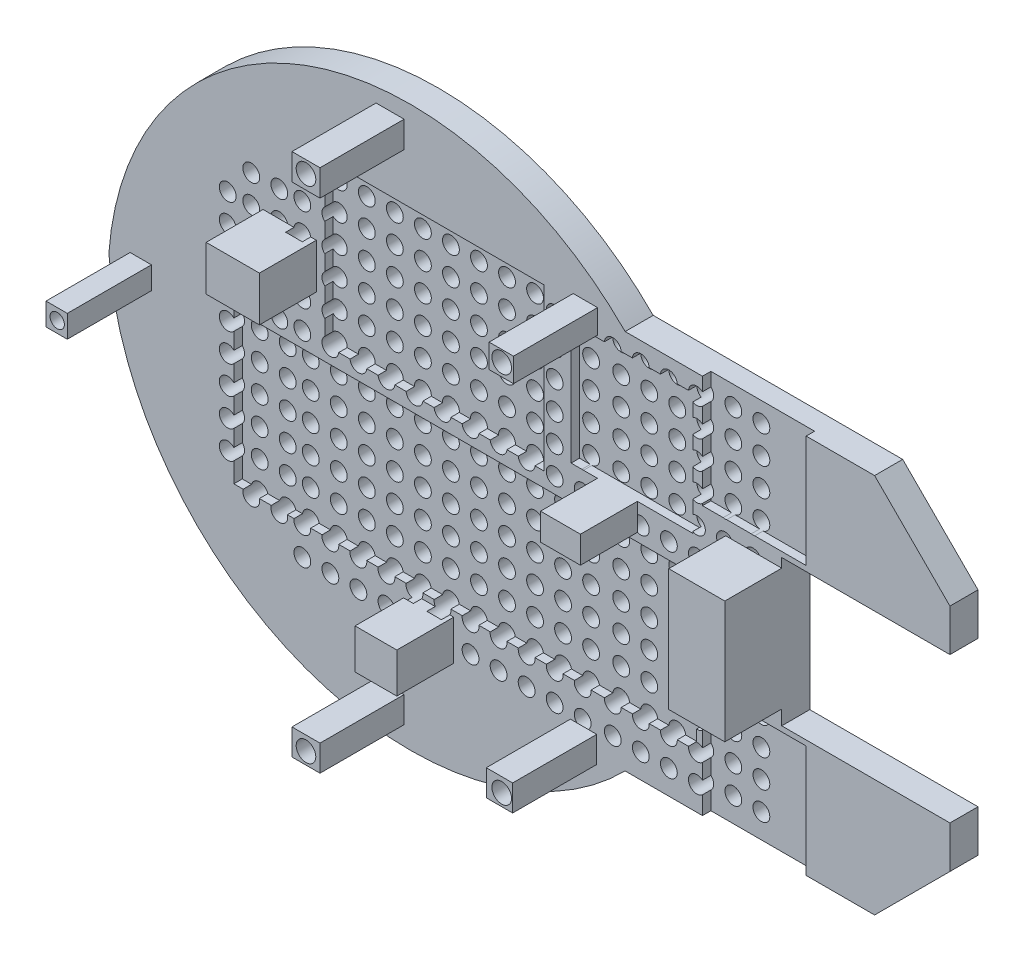
from build123d import *

# Parameters (mm, degrees)
BOSS_EXTRUDE1_DEPTH      = 10
BOSS_EXTRUDE1_DEPTH_BACK = 0.01
SKETCH3_W                = 37
SKETCH3_H                = 40
CUT_EXTRUDE1_DEPTH       = 3
SKETCH5_W                = 37
SKETCH5_H                = 40
CUT_EXTRUDE3_DEPTH       = 3
SKETCH7_W                = 165
SKETCH7_H                = 54
CUT_EXTRUDE4_DEPTH       = 3
SKETCH8_W                = 78.2
SKETCH8_H                = 57.5
CUT_EXTRUDE5_DEPTH       = 3
SKETCH9_W                = 19
SKETCH9_H                = 16
SKETCH9_W_2              = 14.238670971
SKETCH9_H_2              = 13.143388588
SKETCH9_W_3              = 14.8958404
SKETCH9_H_3              = 14.23867097
BOSS_EXTRUDE2_DEPTH      = 20.3
SKETCH11_R               = 3
CUT_EXTRUDE12_DEPTH      = 13
CUT_EXTRUDE13_REACH      = 263.683
SKETCH12_R               = 3
CUT_EXTRUDE14_REACH      = 263.683
SKETCH13_R               = 3
SKETCH14_R               = 3
CUT_EXTRUDE16_DEPTH      = 10.01
SKETCH15_W               = 20
SKETCH15_H               = 43.5
BOSS_EXTRUDE3_DEPTH      = 20.3
SKETCH16_W               = 7.597238681
SKETCH16_H               = 8
SKETCH16_W_2             = 10
SKETCH16_H_2             = 9.4
SKETCH16_W_3             = 8.7
SKETCH16_H_3             = 8.5
SKETCH16_W_4             = 9.4
SKETCH16_H_4             = 9.3
BOSS_EXTRUDE4_DEPTH      = 30
SKETCH17_R               = 2.55
SKETCH17_R_2             = 3.5
CUT_EXTRUDE17_DEPTH      = 263.98121496
SKETCH18_W               = 43.4
SKETCH18_H               = 43.4
CUT_EXTRUDE18_DEPTH      = 3
SKETCH19_W               = 14.238670971
SKETCH19_H               = 3.554233488
CUT_EXTRUDE19_DEPTH      = 23.3


with BuildPart() as part:
    # Sketch1 → Boss-Extrude1 (new, two sides: drawn at the far end of the back side and taken through both)
    with BuildSketch(Plane.XY.offset(-BOSS_EXTRUDE1_DEPTH_BACK)):
        with BuildLine():
            Line((0, 0), (0, -26))
            Line((0, -26), (60, -26))
            Line((60, -26), (60, -41))
            Line((60, -41), (33.129942315, -67.870057685))
            Line((33.129942315, -67.870057685), (-55.850057685, -67.870057685))
            ThreePointArc((-55.850057685, -67.870057685), (-169.745893523, -93.14097487), (-240, 0))
            ThreePointArc((-240, 0), (-169.745893523, 93.14097487), (-55.850057685, 67.870057685))
            Line((-55.850057685, 67.870057685), (33.129942315, 67.870057685))
            Line((33.129942315, 67.870057685), (60, 41))
            Line((60, 41), (60, 26))
            Line((60, 26), (0, 26))
            Line((0, 26), (0, 0))
        make_face()
    extrude(amount=BOSS_EXTRUDE1_DEPTH + BOSS_EXTRUDE1_DEPTH_BACK)

    # Sketch3 → Cut-Extrude1 (cut)
    with BuildSketch(Plane.XY.offset(10)):
        with Locations((-9.773002586, 47.870057685)):
            Rectangle(SKETCH3_W, SKETCH3_H)
    extrude(amount=-CUT_EXTRUDE1_DEPTH, mode=Mode.SUBTRACT)

    # Sketch5 → Cut-Extrude3 (cut)
    with BuildSketch(Plane.XY.offset(10)):
        with Locations((-9.773002586, -47.870057685)):
            Rectangle(SKETCH5_W, SKETCH5_H)
    extrude(amount=-CUT_EXTRUDE3_DEPTH, mode=Mode.SUBTRACT)

    # Sketch7 → Cut-Extrude4 (cut)
    with BuildSketch(Plane.XY.offset(10)):
        with Locations((-112.913094129, -21.943838981)):
            Rectangle(SKETCH7_W, SKETCH7_H)
    extrude(amount=-CUT_EXTRUDE4_DEPTH, mode=Mode.SUBTRACT)

    # Sketch8 → Cut-Extrude5 (cut)
    with BuildSketch(Plane.XY.offset(10)):
        with Locations((-123.892735612, 39.063262975)):
            Rectangle(SKETCH8_W, SKETCH8_H)
    extrude(amount=-CUT_EXTRUDE5_DEPTH, mode=Mode.SUBTRACT)

    # Sketch9 → Boss-Extrude2 (add)
    with BuildSketch(Plane.XY.offset(10)):
        with Locations((-175.5, 33)):
            Rectangle(SKETCH9_W, SKETCH9_H)
        with Locations((-58.612324577, 14.582539194)):
            Rectangle(SKETCH9_W_2, SKETCH9_H_2)
        with Locations((-124.438795754, -58.044490005)):
            Rectangle(SKETCH9_W_3, SKETCH9_H_3)
    extrude(amount=BOSS_EXTRUDE2_DEPTH)

    # Sketch11 → Cut-Extrude12 (cut)
    with BuildSketch(Plane(origin=(0, 0, -0.01), x_dir=(-1, 0, 0), z_dir=(0, 0, -1))):
        with Locations((70.989015497, 60.584399251)):
            Circle(SKETCH11_R)
        with Locations((80.989015497, 60.584399251)):
            Circle(SKETCH11_R)
        with Locations((90.989015497, 60.584399251)):
            Circle(SKETCH11_R)
        with Locations((100.989015497, 60.584399251)):
            Circle(SKETCH11_R)
        with Locations((110.989015497, 60.584399251)):
            Circle(SKETCH11_R)
        with Locations((120.989015497, 60.584399251)):
            Circle(SKETCH11_R)
        with Locations((130.989015497, 60.584399251)):
            Circle(SKETCH11_R)
        with Locations((140.989015497, 60.584399251)):
            Circle(SKETCH11_R)
        with Locations((150.989015497, 60.584399251)):
            Circle(SKETCH11_R)
        with Locations((160.989015497, 60.584399251)):
            Circle(SKETCH11_R)
        with Locations((170.989015497, 60.584399251)):
            Circle(SKETCH11_R)
        with Locations((80.989015497, 50.584399251)):
            Circle(SKETCH11_R)
        with Locations((90.989015497, 50.584399251)):
            Circle(SKETCH11_R)
        with Locations((100.989015497, 50.584399251)):
            Circle(SKETCH11_R)
        with Locations((110.989015497, 50.584399251)):
            Circle(SKETCH11_R)
        with Locations((120.989015497, 50.584399251)):
            Circle(SKETCH11_R)
        with Locations((130.989015497, 50.584399251)):
            Circle(SKETCH11_R)
        with Locations((140.989015497, 50.584399251)):
            Circle(SKETCH11_R)
        with Locations((150.989015497, 50.584399251)):
            Circle(SKETCH11_R)
        with Locations((160.989015497, 50.584399251)):
            Circle(SKETCH11_R)
        with Locations((170.989015497, 50.584399251)):
            Circle(SKETCH11_R)
        with Locations((80.989015497, 40.584399251)):
            Circle(SKETCH11_R)
        with Locations((90.989015497, 40.584399251)):
            Circle(SKETCH11_R)
        with Locations((100.989015497, 40.584399251)):
            Circle(SKETCH11_R)
        with Locations((110.989015497, 40.584399251)):
            Circle(SKETCH11_R)
        with Locations((120.989015497, 40.584399251)):
            Circle(SKETCH11_R)
        with Locations((130.989015497, 40.584399251)):
            Circle(SKETCH11_R)
        with Locations((140.989015497, 40.584399251)):
            Circle(SKETCH11_R)
        with Locations((150.989015497, 40.584399251)):
            Circle(SKETCH11_R)
        with Locations((160.989015497, 40.584399251)):
            Circle(SKETCH11_R)
        with Locations((170.989015497, 40.584399251)):
            Circle(SKETCH11_R)
        with Locations((80.989015497, 30.584399251)):
            Circle(SKETCH11_R)
        with Locations((90.989015497, 30.584399251)):
            Circle(SKETCH11_R)
        with Locations((100.989015497, 30.584399251)):
            Circle(SKETCH11_R)
        with Locations((110.989015497, 30.584399251)):
            Circle(SKETCH11_R)
        with Locations((120.989015497, 30.584399251)):
            Circle(SKETCH11_R)
        with Locations((130.989015497, 30.584399251)):
            Circle(SKETCH11_R)
        with Locations((140.989015497, 30.584399251)):
            Circle(SKETCH11_R)
        with Locations((150.989015497, 30.584399251)):
            Circle(SKETCH11_R)
        with Locations((160.989015497, 30.584399251)):
            Circle(SKETCH11_R)
        with Locations((170.989015497, 30.584399251)):
            Circle(SKETCH11_R)
        with Locations((80.989015497, 20.584399251)):
            Circle(SKETCH11_R)
        with Locations((90.989015497, 20.584399251)):
            Circle(SKETCH11_R)
        with Locations((100.989015497, 20.584399251)):
            Circle(SKETCH11_R)
        with Locations((110.989015497, 20.584399251)):
            Circle(SKETCH11_R)
        with Locations((120.989015497, 20.584399251)):
            Circle(SKETCH11_R)
        with Locations((130.989015497, 20.584399251)):
            Circle(SKETCH11_R)
        with Locations((140.989015497, 20.584399251)):
            Circle(SKETCH11_R)
        with Locations((150.989015497, 20.584399251)):
            Circle(SKETCH11_R)
        with Locations((160.989015497, 20.584399251)):
            Circle(SKETCH11_R)
        with Locations((170.989015497, 20.584399251)):
            Circle(SKETCH11_R)
        with Locations((80.989015497, 10.584399251)):
            Circle(SKETCH11_R)
        with Locations((90.989015497, 10.584399251)):
            Circle(SKETCH11_R)
        with Locations((100.989015497, 10.584399251)):
            Circle(SKETCH11_R)
        with Locations((110.989015497, 10.584399251)):
            Circle(SKETCH11_R)
        with Locations((120.989015497, 10.584399251)):
            Circle(SKETCH11_R)
        with Locations((130.989015497, 10.584399251)):
            Circle(SKETCH11_R)
        with Locations((140.989015497, 10.584399251)):
            Circle(SKETCH11_R)
        with Locations((150.989015497, 10.584399251)):
            Circle(SKETCH11_R)
        with Locations((160.989015497, 10.584399251)):
            Circle(SKETCH11_R)
        with Locations((170.989015497, 10.584399251)):
            Circle(SKETCH11_R)
        with Locations((80.989015497, 0.584399251)):
            Circle(SKETCH11_R)
        with Locations((90.989015497, 0.584399251)):
            Circle(SKETCH11_R)
        with Locations((100.989015497, 0.584399251)):
            Circle(SKETCH11_R)
        with Locations((110.989015497, 0.584399251)):
            Circle(SKETCH11_R)
        with Locations((120.989015497, 0.584399251)):
            Circle(SKETCH11_R)
        with Locations((130.989015497, 0.584399251)):
            Circle(SKETCH11_R)
        with Locations((140.989015497, 0.584399251)):
            Circle(SKETCH11_R)
        with Locations((150.989015497, 0.584399251)):
            Circle(SKETCH11_R)
        with Locations((160.989015497, 0.584399251)):
            Circle(SKETCH11_R)
        with Locations((170.989015497, 0.584399251)):
            Circle(SKETCH11_R)
        with Locations((80.989015497, -9.415600749)):
            Circle(SKETCH11_R)
        with Locations((90.989015497, -9.415600749)):
            Circle(SKETCH11_R)
        with Locations((100.989015497, -9.415600749)):
            Circle(SKETCH11_R)
        with Locations((110.989015497, -9.415600749)):
            Circle(SKETCH11_R)
        with Locations((120.989015497, -9.415600749)):
            Circle(SKETCH11_R)
        with Locations((130.989015497, -9.415600749)):
            Circle(SKETCH11_R)
        with Locations((140.989015497, -9.415600749)):
            Circle(SKETCH11_R)
        with Locations((150.989015497, -9.415600749)):
            Circle(SKETCH11_R)
        with Locations((160.989015497, -9.415600749)):
            Circle(SKETCH11_R)
        with Locations((170.989015497, -9.415600749)):
            Circle(SKETCH11_R)
        with Locations((80.989015497, -19.415600749)):
            Circle(SKETCH11_R)
        with Locations((90.989015497, -19.415600749)):
            Circle(SKETCH11_R)
        with Locations((100.989015497, -19.415600749)):
            Circle(SKETCH11_R)
        with Locations((110.989015497, -19.415600749)):
            Circle(SKETCH11_R)
        with Locations((120.989015497, -19.415600749)):
            Circle(SKETCH11_R)
        with Locations((130.989015497, -19.415600749)):
            Circle(SKETCH11_R)
        with Locations((140.989015497, -19.415600749)):
            Circle(SKETCH11_R)
        with Locations((150.989015497, -19.415600749)):
            Circle(SKETCH11_R)
        with Locations((160.989015497, -19.415600749)):
            Circle(SKETCH11_R)
        with Locations((170.989015497, -19.415600749)):
            Circle(SKETCH11_R)
        with Locations((80.989015497, -29.415600749)):
            Circle(SKETCH11_R)
        with Locations((90.989015497, -29.415600749)):
            Circle(SKETCH11_R)
        with Locations((100.989015497, -29.415600749)):
            Circle(SKETCH11_R)
        with Locations((110.989015497, -29.415600749)):
            Circle(SKETCH11_R)
        with Locations((120.989015497, -29.415600749)):
            Circle(SKETCH11_R)
        with Locations((130.989015497, -29.415600749)):
            Circle(SKETCH11_R)
        with Locations((140.989015497, -29.415600749)):
            Circle(SKETCH11_R)
        with Locations((150.989015497, -29.415600749)):
            Circle(SKETCH11_R)
        with Locations((160.989015497, -29.415600749)):
            Circle(SKETCH11_R)
        with Locations((170.989015497, -29.415600749)):
            Circle(SKETCH11_R)
        with Locations((80.989015497, -39.415600749)):
            Circle(SKETCH11_R)
        with Locations((90.989015497, -39.415600749)):
            Circle(SKETCH11_R)
        with Locations((100.989015497, -39.415600749)):
            Circle(SKETCH11_R)
        with Locations((110.989015497, -39.415600749)):
            Circle(SKETCH11_R)
        with Locations((120.989015497, -39.415600749)):
            Circle(SKETCH11_R)
        with Locations((130.989015497, -39.415600749)):
            Circle(SKETCH11_R)
        with Locations((140.989015497, -39.415600749)):
            Circle(SKETCH11_R)
        with Locations((150.989015497, -39.415600749)):
            Circle(SKETCH11_R)
        with Locations((160.989015497, -39.415600749)):
            Circle(SKETCH11_R)
        with Locations((170.989015497, -39.415600749)):
            Circle(SKETCH11_R)
        with Locations((80.989015497, -49.415600749)):
            Circle(SKETCH11_R)
        with Locations((90.989015497, -49.415600749)):
            Circle(SKETCH11_R)
        with Locations((100.989015497, -49.415600749)):
            Circle(SKETCH11_R)
        with Locations((110.989015497, -49.415600749)):
            Circle(SKETCH11_R)
        with Locations((120.989015497, -49.415600749)):
            Circle(SKETCH11_R)
        with Locations((130.989015497, -49.415600749)):
            Circle(SKETCH11_R)
        with Locations((140.989015497, -49.415600749)):
            Circle(SKETCH11_R)
        with Locations((150.989015497, -49.415600749)):
            Circle(SKETCH11_R)
        with Locations((160.989015497, -49.415600749)):
            Circle(SKETCH11_R)
        with Locations((170.989015497, -49.415600749)):
            Circle(SKETCH11_R)
        with Locations((80.989015497, -59.415600749)):
            Circle(SKETCH11_R)
        with Locations((90.989015497, -59.415600749)):
            Circle(SKETCH11_R)
        with Locations((100.989015497, -59.415600749)):
            Circle(SKETCH11_R)
        with Locations((110.989015497, -59.415600749)):
            Circle(SKETCH11_R)
        with Locations((120.989015497, -59.415600749)):
            Circle(SKETCH11_R)
        with Locations((130.989015497, -59.415600749)):
            Circle(SKETCH11_R)
        with Locations((140.989015497, -59.415600749)):
            Circle(SKETCH11_R)
        with Locations((150.989015497, -59.415600749)):
            Circle(SKETCH11_R)
        with Locations((160.989015497, -59.415600749)):
            Circle(SKETCH11_R)
        with Locations((170.989015497, -59.415600749)):
            Circle(SKETCH11_R)
        with Locations((70.989015497, 50.584399251)):
            Circle(SKETCH11_R)
        with Locations((70.989015497, 40.584399251)):
            Circle(SKETCH11_R)
        with Locations((70.989015497, 30.584399251)):
            Circle(SKETCH11_R)
        with Locations((70.989015497, 20.584399251)):
            Circle(SKETCH11_R)
        with Locations((70.989015497, 10.584399251)):
            Circle(SKETCH11_R)
        with Locations((70.989015497, 0.584399251)):
            Circle(SKETCH11_R)
        with Locations((70.989015497, -9.415600749)):
            Circle(SKETCH11_R)
        with Locations((70.989015497, -19.415600749)):
            Circle(SKETCH11_R)
        with Locations((70.989015497, -29.415600749)):
            Circle(SKETCH11_R)
        with Locations((70.989015497, -39.415600749)):
            Circle(SKETCH11_R)
        with Locations((70.989015497, -49.415600749)):
            Circle(SKETCH11_R)
        with Locations((70.989015497, -59.415600749)):
            Circle(SKETCH11_R)
    extrude(amount=-CUT_EXTRUDE12_DEPTH, mode=Mode.SUBTRACT)

    # Cut-Extrude13: up to this face of the body (flat: up to its plane)
    cut_extrude13_end = Plane(part.part.faces().sort_by_distance((56.396717085, 33.5, 10))[0])
    # Sketch12 → Cut-Extrude13 (cut, up to the picked face)
    with BuildSketch(Plane(origin=(0, 0, -0.01), x_dir=(-1, 0, 0), z_dir=(0, 0, -1)), mode=Mode.PRIVATE) as cut_extrude13_sk1:
        with Locations((179.20291487, 50.26025315)):
            Circle(SKETCH12_R)
    cut_extrude13_tool1 = split(extrude(cut_extrude13_sk1.sketch, amount=-CUT_EXTRUDE13_REACH, mode=Mode.PRIVATE), bisect_by=cut_extrude13_end, keep=Keep.BOTH, mode=Mode.PRIVATE)
    # Sketch12 → Cut-Extrude13 (cut, up to the picked face)
    with BuildSketch(Plane(origin=(0, 0, -0.01), x_dir=(-1, 0, 0), z_dir=(0, 0, -1)), mode=Mode.PRIVATE) as cut_extrude13_sk2:
        with Locations((189.20291487, 50.26025315)):
            Circle(SKETCH12_R)
    cut_extrude13_tool2 = split(extrude(cut_extrude13_sk2.sketch, amount=-CUT_EXTRUDE13_REACH, mode=Mode.PRIVATE), bisect_by=cut_extrude13_end, keep=Keep.BOTH, mode=Mode.PRIVATE)
    # Sketch12 → Cut-Extrude13 (cut, up to the picked face)
    with BuildSketch(Plane(origin=(0, 0, -0.01), x_dir=(-1, 0, 0), z_dir=(0, 0, -1)), mode=Mode.PRIVATE) as cut_extrude13_sk3:
        with Locations((189.20291487, 40.26025315)):
            Circle(SKETCH12_R)
    cut_extrude13_tool3 = split(extrude(cut_extrude13_sk3.sketch, amount=-CUT_EXTRUDE13_REACH, mode=Mode.PRIVATE), bisect_by=cut_extrude13_end, keep=Keep.BOTH, mode=Mode.PRIVATE)
    # Sketch12 → Cut-Extrude13 (cut, up to the picked face)
    with BuildSketch(Plane(origin=(0, 0, -0.01), x_dir=(-1, 0, 0), z_dir=(0, 0, -1)), mode=Mode.PRIVATE) as cut_extrude13_sk4:
        with Locations((189.20291487, 30.26025315)):
            Circle(SKETCH12_R)
    cut_extrude13_tool4 = split(extrude(cut_extrude13_sk4.sketch, amount=-CUT_EXTRUDE13_REACH, mode=Mode.PRIVATE), bisect_by=cut_extrude13_end, keep=Keep.BOTH, mode=Mode.PRIVATE)
    # Sketch12 → Cut-Extrude13 (cut, up to the picked face)
    with BuildSketch(Plane(origin=(0, 0, -0.01), x_dir=(-1, 0, 0), z_dir=(0, 0, -1)), mode=Mode.PRIVATE) as cut_extrude13_sk5:
        with Locations((189.20291487, 20.26025315)):
            Circle(SKETCH12_R)
    cut_extrude13_tool5 = split(extrude(cut_extrude13_sk5.sketch, amount=-CUT_EXTRUDE13_REACH, mode=Mode.PRIVATE), bisect_by=cut_extrude13_end, keep=Keep.BOTH, mode=Mode.PRIVATE)
    # Sketch12 → Cut-Extrude13 (cut, up to the picked face)
    with BuildSketch(Plane(origin=(0, 0, -0.01), x_dir=(-1, 0, 0), z_dir=(0, 0, -1)), mode=Mode.PRIVATE) as cut_extrude13_sk6:
        with Locations((189.20291487, 10.26025315)):
            Circle(SKETCH12_R)
    cut_extrude13_tool6 = split(extrude(cut_extrude13_sk6.sketch, amount=-CUT_EXTRUDE13_REACH, mode=Mode.PRIVATE), bisect_by=cut_extrude13_end, keep=Keep.BOTH, mode=Mode.PRIVATE)
    # Sketch12 → Cut-Extrude13 (cut, up to the picked face)
    with BuildSketch(Plane(origin=(0, 0, -0.01), x_dir=(-1, 0, 0), z_dir=(0, 0, -1)), mode=Mode.PRIVATE) as cut_extrude13_sk7:
        with Locations((189.20291487, 0.26025315)):
            Circle(SKETCH12_R)
    cut_extrude13_tool7 = split(extrude(cut_extrude13_sk7.sketch, amount=-CUT_EXTRUDE13_REACH, mode=Mode.PRIVATE), bisect_by=cut_extrude13_end, keep=Keep.BOTH, mode=Mode.PRIVATE)
    # Sketch12 → Cut-Extrude13 (cut, up to the picked face)
    with BuildSketch(Plane(origin=(0, 0, -0.01), x_dir=(-1, 0, 0), z_dir=(0, 0, -1)), mode=Mode.PRIVATE) as cut_extrude13_sk8:
        with Locations((189.20291487, -9.73974685)):
            Circle(SKETCH12_R)
    cut_extrude13_tool8 = split(extrude(cut_extrude13_sk8.sketch, amount=-CUT_EXTRUDE13_REACH, mode=Mode.PRIVATE), bisect_by=cut_extrude13_end, keep=Keep.BOTH, mode=Mode.PRIVATE)
    # Sketch12 → Cut-Extrude13 (cut, up to the picked face)
    with BuildSketch(Plane(origin=(0, 0, -0.01), x_dir=(-1, 0, 0), z_dir=(0, 0, -1)), mode=Mode.PRIVATE) as cut_extrude13_sk9:
        with Locations((189.20291487, -19.73974685)):
            Circle(SKETCH12_R)
    cut_extrude13_tool9 = split(extrude(cut_extrude13_sk9.sketch, amount=-CUT_EXTRUDE13_REACH, mode=Mode.PRIVATE), bisect_by=cut_extrude13_end, keep=Keep.BOTH, mode=Mode.PRIVATE)
    # Sketch12 → Cut-Extrude13 (cut, up to the picked face)
    with BuildSketch(Plane(origin=(0, 0, -0.01), x_dir=(-1, 0, 0), z_dir=(0, 0, -1)), mode=Mode.PRIVATE) as cut_extrude13_sk10:
        with Locations((189.20291487, -29.73974685)):
            Circle(SKETCH12_R)
    cut_extrude13_tool10 = split(extrude(cut_extrude13_sk10.sketch, amount=-CUT_EXTRUDE13_REACH, mode=Mode.PRIVATE), bisect_by=cut_extrude13_end, keep=Keep.BOTH, mode=Mode.PRIVATE)
    # Sketch12 → Cut-Extrude13 (cut, up to the picked face)
    with BuildSketch(Plane(origin=(0, 0, -0.01), x_dir=(-1, 0, 0), z_dir=(0, 0, -1)), mode=Mode.PRIVATE) as cut_extrude13_sk11:
        with Locations((189.20291487, -39.73974685)):
            Circle(SKETCH12_R)
    cut_extrude13_tool11 = split(extrude(cut_extrude13_sk11.sketch, amount=-CUT_EXTRUDE13_REACH, mode=Mode.PRIVATE), bisect_by=cut_extrude13_end, keep=Keep.BOTH, mode=Mode.PRIVATE)
    # Sketch12 → Cut-Extrude13 (cut, up to the picked face)
    with BuildSketch(Plane(origin=(0, 0, -0.01), x_dir=(-1, 0, 0), z_dir=(0, 0, -1)), mode=Mode.PRIVATE) as cut_extrude13_sk12:
        with Locations((189.20291487, -49.73974685)):
            Circle(SKETCH12_R)
    cut_extrude13_tool12 = split(extrude(cut_extrude13_sk12.sketch, amount=-CUT_EXTRUDE13_REACH, mode=Mode.PRIVATE), bisect_by=cut_extrude13_end, keep=Keep.BOTH, mode=Mode.PRIVATE)
    # Sketch12 → Cut-Extrude13 (cut, up to the picked face)
    with BuildSketch(Plane(origin=(0, 0, -0.01), x_dir=(-1, 0, 0), z_dir=(0, 0, -1)), mode=Mode.PRIVATE) as cut_extrude13_sk13:
        with Locations((179.20291487, 40.26025315)):
            Circle(SKETCH12_R)
    cut_extrude13_tool13 = split(extrude(cut_extrude13_sk13.sketch, amount=-CUT_EXTRUDE13_REACH, mode=Mode.PRIVATE), bisect_by=cut_extrude13_end, keep=Keep.BOTH, mode=Mode.PRIVATE)
    # Sketch12 → Cut-Extrude13 (cut, up to the picked face)
    with BuildSketch(Plane(origin=(0, 0, -0.01), x_dir=(-1, 0, 0), z_dir=(0, 0, -1)), mode=Mode.PRIVATE) as cut_extrude13_sk14:
        with Locations((179.20291487, 30.26025315)):
            Circle(SKETCH12_R)
    cut_extrude13_tool14 = split(extrude(cut_extrude13_sk14.sketch, amount=-CUT_EXTRUDE13_REACH, mode=Mode.PRIVATE), bisect_by=cut_extrude13_end, keep=Keep.BOTH, mode=Mode.PRIVATE)
    # Sketch12 → Cut-Extrude13 (cut, up to the picked face)
    with BuildSketch(Plane(origin=(0, 0, -0.01), x_dir=(-1, 0, 0), z_dir=(0, 0, -1)), mode=Mode.PRIVATE) as cut_extrude13_sk15:
        with Locations((179.20291487, 20.26025315)):
            Circle(SKETCH12_R)
    cut_extrude13_tool15 = split(extrude(cut_extrude13_sk15.sketch, amount=-CUT_EXTRUDE13_REACH, mode=Mode.PRIVATE), bisect_by=cut_extrude13_end, keep=Keep.BOTH, mode=Mode.PRIVATE)
    # Sketch12 → Cut-Extrude13 (cut, up to the picked face)
    with BuildSketch(Plane(origin=(0, 0, -0.01), x_dir=(-1, 0, 0), z_dir=(0, 0, -1)), mode=Mode.PRIVATE) as cut_extrude13_sk16:
        with Locations((179.20291487, 10.26025315)):
            Circle(SKETCH12_R)
    cut_extrude13_tool16 = split(extrude(cut_extrude13_sk16.sketch, amount=-CUT_EXTRUDE13_REACH, mode=Mode.PRIVATE), bisect_by=cut_extrude13_end, keep=Keep.BOTH, mode=Mode.PRIVATE)
    # Sketch12 → Cut-Extrude13 (cut, up to the picked face)
    with BuildSketch(Plane(origin=(0, 0, -0.01), x_dir=(-1, 0, 0), z_dir=(0, 0, -1)), mode=Mode.PRIVATE) as cut_extrude13_sk17:
        with Locations((179.20291487, 0.26025315)):
            Circle(SKETCH12_R)
    cut_extrude13_tool17 = split(extrude(cut_extrude13_sk17.sketch, amount=-CUT_EXTRUDE13_REACH, mode=Mode.PRIVATE), bisect_by=cut_extrude13_end, keep=Keep.BOTH, mode=Mode.PRIVATE)
    # Sketch12 → Cut-Extrude13 (cut, up to the picked face)
    with BuildSketch(Plane(origin=(0, 0, -0.01), x_dir=(-1, 0, 0), z_dir=(0, 0, -1)), mode=Mode.PRIVATE) as cut_extrude13_sk18:
        with Locations((179.20291487, -9.73974685)):
            Circle(SKETCH12_R)
    cut_extrude13_tool18 = split(extrude(cut_extrude13_sk18.sketch, amount=-CUT_EXTRUDE13_REACH, mode=Mode.PRIVATE), bisect_by=cut_extrude13_end, keep=Keep.BOTH, mode=Mode.PRIVATE)
    # Sketch12 → Cut-Extrude13 (cut, up to the picked face)
    with BuildSketch(Plane(origin=(0, 0, -0.01), x_dir=(-1, 0, 0), z_dir=(0, 0, -1)), mode=Mode.PRIVATE) as cut_extrude13_sk19:
        with Locations((179.20291487, -19.73974685)):
            Circle(SKETCH12_R)
    cut_extrude13_tool19 = split(extrude(cut_extrude13_sk19.sketch, amount=-CUT_EXTRUDE13_REACH, mode=Mode.PRIVATE), bisect_by=cut_extrude13_end, keep=Keep.BOTH, mode=Mode.PRIVATE)
    # Sketch12 → Cut-Extrude13 (cut, up to the picked face)
    with BuildSketch(Plane(origin=(0, 0, -0.01), x_dir=(-1, 0, 0), z_dir=(0, 0, -1)), mode=Mode.PRIVATE) as cut_extrude13_sk20:
        with Locations((179.20291487, -29.73974685)):
            Circle(SKETCH12_R)
    cut_extrude13_tool20 = split(extrude(cut_extrude13_sk20.sketch, amount=-CUT_EXTRUDE13_REACH, mode=Mode.PRIVATE), bisect_by=cut_extrude13_end, keep=Keep.BOTH, mode=Mode.PRIVATE)
    # Sketch12 → Cut-Extrude13 (cut, up to the picked face)
    with BuildSketch(Plane(origin=(0, 0, -0.01), x_dir=(-1, 0, 0), z_dir=(0, 0, -1)), mode=Mode.PRIVATE) as cut_extrude13_sk21:
        with Locations((179.20291487, -39.73974685)):
            Circle(SKETCH12_R)
    cut_extrude13_tool21 = split(extrude(cut_extrude13_sk21.sketch, amount=-CUT_EXTRUDE13_REACH, mode=Mode.PRIVATE), bisect_by=cut_extrude13_end, keep=Keep.BOTH, mode=Mode.PRIVATE)
    # Sketch12 → Cut-Extrude13 (cut, up to the picked face)
    with BuildSketch(Plane(origin=(0, 0, -0.01), x_dir=(-1, 0, 0), z_dir=(0, 0, -1)), mode=Mode.PRIVATE) as cut_extrude13_sk22:
        with Locations((179.20291487, -49.73974685)):
            Circle(SKETCH12_R)
    cut_extrude13_tool22 = split(extrude(cut_extrude13_sk22.sketch, amount=-CUT_EXTRUDE13_REACH, mode=Mode.PRIVATE), bisect_by=cut_extrude13_end, keep=Keep.BOTH, mode=Mode.PRIVATE)
    add(cut_extrude13_tool1.solids().sort_by(Axis((-179.202915, 50.260253, -0.01), (0, 0, 1)))[0], mode=Mode.SUBTRACT)
    add(cut_extrude13_tool2.solids().sort_by(Axis((-189.202915, 50.260253, -0.01), (0, 0, 1)))[0], mode=Mode.SUBTRACT)
    add(cut_extrude13_tool3.solids().sort_by(Axis((-189.202915, 40.260253, -0.01), (0, 0, 1)))[0], mode=Mode.SUBTRACT)
    add(cut_extrude13_tool4.solids().sort_by(Axis((-189.202915, 30.260253, -0.01), (0, 0, 1)))[0], mode=Mode.SUBTRACT)
    add(cut_extrude13_tool5.solids().sort_by(Axis((-189.202915, 20.260253, -0.01), (0, 0, 1)))[0], mode=Mode.SUBTRACT)
    add(cut_extrude13_tool6.solids().sort_by(Axis((-189.202915, 10.260253, -0.01), (0, 0, 1)))[0], mode=Mode.SUBTRACT)
    add(cut_extrude13_tool7.solids().sort_by(Axis((-189.202915, 0.260253, -0.01), (0, 0, 1)))[0], mode=Mode.SUBTRACT)
    add(cut_extrude13_tool8.solids().sort_by(Axis((-189.202915, -9.739747, -0.01), (0, 0, 1)))[0], mode=Mode.SUBTRACT)
    add(cut_extrude13_tool9.solids().sort_by(Axis((-189.202915, -19.739747, -0.01), (0, 0, 1)))[0], mode=Mode.SUBTRACT)
    add(cut_extrude13_tool10.solids().sort_by(Axis((-189.202915, -29.739747, -0.01), (0, 0, 1)))[0], mode=Mode.SUBTRACT)
    add(cut_extrude13_tool11.solids().sort_by(Axis((-189.202915, -39.739747, -0.01), (0, 0, 1)))[0], mode=Mode.SUBTRACT)
    add(cut_extrude13_tool12.solids().sort_by(Axis((-189.202915, -49.739747, -0.01), (0, 0, 1)))[0], mode=Mode.SUBTRACT)
    add(cut_extrude13_tool13.solids().sort_by(Axis((-179.202915, 40.260253, -0.01), (0, 0, 1)))[0], mode=Mode.SUBTRACT)
    add(cut_extrude13_tool14.solids().sort_by(Axis((-179.202915, 30.260253, -0.01), (0, 0, 1)))[0], mode=Mode.SUBTRACT)
    add(cut_extrude13_tool15.solids().sort_by(Axis((-179.202915, 20.260253, -0.01), (0, 0, 1)))[0], mode=Mode.SUBTRACT)
    add(cut_extrude13_tool16.solids().sort_by(Axis((-179.202915, 10.260253, -0.01), (0, 0, 1)))[0], mode=Mode.SUBTRACT)
    add(cut_extrude13_tool17.solids().sort_by(Axis((-179.202915, 0.260253, -0.01), (0, 0, 1)))[0], mode=Mode.SUBTRACT)
    add(cut_extrude13_tool18.solids().sort_by(Axis((-179.202915, -9.739747, -0.01), (0, 0, 1)))[0], mode=Mode.SUBTRACT)
    add(cut_extrude13_tool19.solids().sort_by(Axis((-179.202915, -19.739747, -0.01), (0, 0, 1)))[0], mode=Mode.SUBTRACT)
    add(cut_extrude13_tool20.solids().sort_by(Axis((-179.202915, -29.739747, -0.01), (0, 0, 1)))[0], mode=Mode.SUBTRACT)
    add(cut_extrude13_tool21.solids().sort_by(Axis((-179.202915, -39.739747, -0.01), (0, 0, 1)))[0], mode=Mode.SUBTRACT)
    add(cut_extrude13_tool22.solids().sort_by(Axis((-179.202915, -49.739747, -0.01), (0, 0, 1)))[0], mode=Mode.SUBTRACT)

    # Cut-Extrude14: up to this face of the body (flat: up to its plane)
    cut_extrude14_end = Plane(part.part.faces().sort_by_distance((56.396717085, 33.5, 10))[0])
    # Sketch13 → Cut-Extrude14 (cut, up to the picked face)
    with BuildSketch(Plane(origin=(0, 0, -0.01), x_dir=(-1, 0, 0), z_dir=(0, 0, -1)), mode=Mode.PRIVATE) as cut_extrude14_sk1:
        with Locations((197.603658893, 40.21214694)):
            Circle(SKETCH13_R)
    cut_extrude14_tool1 = split(extrude(cut_extrude14_sk1.sketch, amount=-CUT_EXTRUDE14_REACH, mode=Mode.PRIVATE), bisect_by=cut_extrude14_end, keep=Keep.BOTH, mode=Mode.PRIVATE)
    # Sketch13 → Cut-Extrude14 (cut, up to the picked face)
    with BuildSketch(Plane(origin=(0, 0, -0.01), x_dir=(-1, 0, 0), z_dir=(0, 0, -1)), mode=Mode.PRIVATE) as cut_extrude14_sk2:
        with Locations((197.603658893, 30.21214694)):
            Circle(SKETCH13_R)
    cut_extrude14_tool2 = split(extrude(cut_extrude14_sk2.sketch, amount=-CUT_EXTRUDE14_REACH, mode=Mode.PRIVATE), bisect_by=cut_extrude14_end, keep=Keep.BOTH, mode=Mode.PRIVATE)
    # Sketch13 → Cut-Extrude14 (cut, up to the picked face)
    with BuildSketch(Plane(origin=(0, 0, -0.01), x_dir=(-1, 0, 0), z_dir=(0, 0, -1)), mode=Mode.PRIVATE) as cut_extrude14_sk3:
        with Locations((197.603658893, 20.21214694)):
            Circle(SKETCH13_R)
    cut_extrude14_tool3 = split(extrude(cut_extrude14_sk3.sketch, amount=-CUT_EXTRUDE14_REACH, mode=Mode.PRIVATE), bisect_by=cut_extrude14_end, keep=Keep.BOTH, mode=Mode.PRIVATE)
    # Sketch13 → Cut-Extrude14 (cut, up to the picked face)
    with BuildSketch(Plane(origin=(0, 0, -0.01), x_dir=(-1, 0, 0), z_dir=(0, 0, -1)), mode=Mode.PRIVATE) as cut_extrude14_sk4:
        with Locations((197.603658893, 10.21214694)):
            Circle(SKETCH13_R)
    cut_extrude14_tool4 = split(extrude(cut_extrude14_sk4.sketch, amount=-CUT_EXTRUDE14_REACH, mode=Mode.PRIVATE), bisect_by=cut_extrude14_end, keep=Keep.BOTH, mode=Mode.PRIVATE)
    # Sketch13 → Cut-Extrude14 (cut, up to the picked face)
    with BuildSketch(Plane(origin=(0, 0, -0.01), x_dir=(-1, 0, 0), z_dir=(0, 0, -1)), mode=Mode.PRIVATE) as cut_extrude14_sk5:
        with Locations((197.603658893, 0.21214694)):
            Circle(SKETCH13_R)
    cut_extrude14_tool5 = split(extrude(cut_extrude14_sk5.sketch, amount=-CUT_EXTRUDE14_REACH, mode=Mode.PRIVATE), bisect_by=cut_extrude14_end, keep=Keep.BOTH, mode=Mode.PRIVATE)
    # Sketch13 → Cut-Extrude14 (cut, up to the picked face)
    with BuildSketch(Plane(origin=(0, 0, -0.01), x_dir=(-1, 0, 0), z_dir=(0, 0, -1)), mode=Mode.PRIVATE) as cut_extrude14_sk6:
        with Locations((197.603658893, -9.78785306)):
            Circle(SKETCH13_R)
    cut_extrude14_tool6 = split(extrude(cut_extrude14_sk6.sketch, amount=-CUT_EXTRUDE14_REACH, mode=Mode.PRIVATE), bisect_by=cut_extrude14_end, keep=Keep.BOTH, mode=Mode.PRIVATE)
    # Sketch13 → Cut-Extrude14 (cut, up to the picked face)
    with BuildSketch(Plane(origin=(0, 0, -0.01), x_dir=(-1, 0, 0), z_dir=(0, 0, -1)), mode=Mode.PRIVATE) as cut_extrude14_sk7:
        with Locations((197.603658893, -19.78785306)):
            Circle(SKETCH13_R)
    cut_extrude14_tool7 = split(extrude(cut_extrude14_sk7.sketch, amount=-CUT_EXTRUDE14_REACH, mode=Mode.PRIVATE), bisect_by=cut_extrude14_end, keep=Keep.BOTH, mode=Mode.PRIVATE)
    # Sketch13 → Cut-Extrude14 (cut, up to the picked face)
    with BuildSketch(Plane(origin=(0, 0, -0.01), x_dir=(-1, 0, 0), z_dir=(0, 0, -1)), mode=Mode.PRIVATE) as cut_extrude14_sk8:
        with Locations((197.603658893, -29.78785306)):
            Circle(SKETCH13_R)
    cut_extrude14_tool8 = split(extrude(cut_extrude14_sk8.sketch, amount=-CUT_EXTRUDE14_REACH, mode=Mode.PRIVATE), bisect_by=cut_extrude14_end, keep=Keep.BOTH, mode=Mode.PRIVATE)
    # Sketch13 → Cut-Extrude14 (cut, up to the picked face)
    with BuildSketch(Plane(origin=(0, 0, -0.01), x_dir=(-1, 0, 0), z_dir=(0, 0, -1)), mode=Mode.PRIVATE) as cut_extrude14_sk9:
        with Locations((197.603658893, -39.78785306)):
            Circle(SKETCH13_R)
    cut_extrude14_tool9 = split(extrude(cut_extrude14_sk9.sketch, amount=-CUT_EXTRUDE14_REACH, mode=Mode.PRIVATE), bisect_by=cut_extrude14_end, keep=Keep.BOTH, mode=Mode.PRIVATE)
    add(cut_extrude14_tool1.solids().sort_by(Axis((-197.603659, 40.212147, -0.01), (0, 0, 1)))[0], mode=Mode.SUBTRACT)
    add(cut_extrude14_tool2.solids().sort_by(Axis((-197.603659, 30.212147, -0.01), (0, 0, 1)))[0], mode=Mode.SUBTRACT)
    add(cut_extrude14_tool3.solids().sort_by(Axis((-197.603659, 20.212147, -0.01), (0, 0, 1)))[0], mode=Mode.SUBTRACT)
    add(cut_extrude14_tool4.solids().sort_by(Axis((-197.603659, 10.212147, -0.01), (0, 0, 1)))[0], mode=Mode.SUBTRACT)
    add(cut_extrude14_tool5.solids().sort_by(Axis((-197.603659, 0.212147, -0.01), (0, 0, 1)))[0], mode=Mode.SUBTRACT)
    add(cut_extrude14_tool6.solids().sort_by(Axis((-197.603659, -9.787853, -0.01), (0, 0, 1)))[0], mode=Mode.SUBTRACT)
    add(cut_extrude14_tool7.solids().sort_by(Axis((-197.603659, -19.787853, -0.01), (0, 0, 1)))[0], mode=Mode.SUBTRACT)
    add(cut_extrude14_tool8.solids().sort_by(Axis((-197.603659, -29.787853, -0.01), (0, 0, 1)))[0], mode=Mode.SUBTRACT)
    add(cut_extrude14_tool9.solids().sort_by(Axis((-197.603659, -39.787853, -0.01), (0, 0, 1)))[0], mode=Mode.SUBTRACT)

    # Sketch14 → Cut-Extrude16 (cut)
    with BuildSketch(Plane(origin=(0, 0, -0.01), x_dir=(-1, 0, 0), z_dir=(0, 0, -1))):
        with Locations((60.25524815, 60.803455728)):
            Circle(SKETCH14_R)
        with Locations((50.25524815, 60.803455728)):
            Circle(SKETCH14_R)
        with Locations((40.25524815, 60.803455728)):
            Circle(SKETCH14_R)
        with Locations((30.25524815, 60.803455728)):
            Circle(SKETCH14_R)
        with Locations((20.25524815, 60.803455728)):
            Circle(SKETCH14_R)
        with Locations((10.25524815, 60.803455728)):
            Circle(SKETCH14_R)
        with Locations((50.25524815, 50.803455728)):
            Circle(SKETCH14_R)
        with Locations((40.25524815, 50.803455728)):
            Circle(SKETCH14_R)
        with Locations((30.25524815, 50.803455728)):
            Circle(SKETCH14_R)
        with Locations((20.25524815, 50.803455728)):
            Circle(SKETCH14_R)
        with Locations((10.25524815, 50.803455728)):
            Circle(SKETCH14_R)
        with Locations((50.25524815, 40.803455728)):
            Circle(SKETCH14_R)
        with Locations((40.25524815, 40.803455728)):
            Circle(SKETCH14_R)
        with Locations((30.25524815, 40.803455728)):
            Circle(SKETCH14_R)
        with Locations((20.25524815, 40.803455728)):
            Circle(SKETCH14_R)
        with Locations((10.25524815, 40.803455728)):
            Circle(SKETCH14_R)
        with Locations((50.25524815, 30.803455728)):
            Circle(SKETCH14_R)
        with Locations((40.25524815, 30.803455728)):
            Circle(SKETCH14_R)
        with Locations((30.25524815, 30.803455728)):
            Circle(SKETCH14_R)
        with Locations((20.25524815, 30.803455728)):
            Circle(SKETCH14_R)
        with Locations((10.25524815, 30.803455728)):
            Circle(SKETCH14_R)
        with Locations((50.25524815, 20.803455728)):
            Circle(SKETCH14_R)
        with Locations((40.25524815, 20.803455728)):
            Circle(SKETCH14_R)
        with Locations((30.25524815, 20.803455728)):
            Circle(SKETCH14_R)
        with Locations((20.25524815, 20.803455728)):
            Circle(SKETCH14_R)
        with Locations((10.25524815, 20.803455728)):
            Circle(SKETCH14_R)
        with Locations((50.25524815, 10.803455728)):
            Circle(SKETCH14_R)
        with Locations((40.25524815, 10.803455728)):
            Circle(SKETCH14_R)
        with Locations((30.25524815, 10.803455728)):
            Circle(SKETCH14_R)
        with Locations((20.25524815, 10.803455728)):
            Circle(SKETCH14_R)
        with Locations((10.25524815, 10.803455728)):
            Circle(SKETCH14_R)
        with Locations((50.25524815, 0.803455728)):
            Circle(SKETCH14_R)
        with Locations((40.25524815, 0.803455728)):
            Circle(SKETCH14_R)
        with Locations((30.25524815, 0.803455728)):
            Circle(SKETCH14_R)
        with Locations((20.25524815, 0.803455728)):
            Circle(SKETCH14_R)
        with Locations((10.25524815, 0.803455728)):
            Circle(SKETCH14_R)
        with Locations((50.25524815, -9.196544272)):
            Circle(SKETCH14_R)
        with Locations((40.25524815, -9.196544272)):
            Circle(SKETCH14_R)
        with Locations((30.25524815, -9.196544272)):
            Circle(SKETCH14_R)
        with Locations((20.25524815, -9.196544272)):
            Circle(SKETCH14_R)
        with Locations((10.25524815, -9.196544272)):
            Circle(SKETCH14_R)
        with Locations((50.25524815, -19.196544272)):
            Circle(SKETCH14_R)
        with Locations((40.25524815, -19.196544272)):
            Circle(SKETCH14_R)
        with Locations((30.25524815, -19.196544272)):
            Circle(SKETCH14_R)
        with Locations((20.25524815, -19.196544272)):
            Circle(SKETCH14_R)
        with Locations((10.25524815, -19.196544272)):
            Circle(SKETCH14_R)
        with Locations((50.25524815, -29.196544272)):
            Circle(SKETCH14_R)
        with Locations((40.25524815, -29.196544272)):
            Circle(SKETCH14_R)
        with Locations((30.25524815, -29.196544272)):
            Circle(SKETCH14_R)
        with Locations((20.25524815, -29.196544272)):
            Circle(SKETCH14_R)
        with Locations((10.25524815, -29.196544272)):
            Circle(SKETCH14_R)
        with Locations((50.25524815, -39.196544272)):
            Circle(SKETCH14_R)
        with Locations((40.25524815, -39.196544272)):
            Circle(SKETCH14_R)
        with Locations((30.25524815, -39.196544272)):
            Circle(SKETCH14_R)
        with Locations((20.25524815, -39.196544272)):
            Circle(SKETCH14_R)
        with Locations((10.25524815, -39.196544272)):
            Circle(SKETCH14_R)
        with Locations((50.25524815, -49.196544272)):
            Circle(SKETCH14_R)
        with Locations((40.25524815, -49.196544272)):
            Circle(SKETCH14_R)
        with Locations((30.25524815, -49.196544272)):
            Circle(SKETCH14_R)
        with Locations((20.25524815, -49.196544272)):
            Circle(SKETCH14_R)
        with Locations((10.25524815, -49.196544272)):
            Circle(SKETCH14_R)
        with Locations((50.25524815, -59.196544272)):
            Circle(SKETCH14_R)
        with Locations((40.25524815, -59.196544272)):
            Circle(SKETCH14_R)
        with Locations((30.25524815, -59.196544272)):
            Circle(SKETCH14_R)
        with Locations((20.25524815, -59.196544272)):
            Circle(SKETCH14_R)
        with Locations((10.25524815, -59.196544272)):
            Circle(SKETCH14_R)
        with Locations((60.25524815, 50.803455728)):
            Circle(SKETCH14_R)
        with Locations((60.25524815, 40.803455728)):
            Circle(SKETCH14_R)
        with Locations((60.25524815, 30.803455728)):
            Circle(SKETCH14_R)
        with Locations((60.25524815, 20.803455728)):
            Circle(SKETCH14_R)
        with Locations((60.25524815, 10.803455728)):
            Circle(SKETCH14_R)
        with Locations((60.25524815, 0.803455728)):
            Circle(SKETCH14_R)
        with Locations((60.25524815, -9.196544272)):
            Circle(SKETCH14_R)
        with Locations((60.25524815, -19.196544272)):
            Circle(SKETCH14_R)
        with Locations((60.25524815, -29.196544272)):
            Circle(SKETCH14_R)
        with Locations((60.25524815, -39.196544272)):
            Circle(SKETCH14_R)
        with Locations((60.25524815, -49.196544272)):
            Circle(SKETCH14_R)
        with Locations((60.25524815, -59.196544272)):
            Circle(SKETCH14_R)
    extrude(amount=-CUT_EXTRUDE16_DEPTH, mode=Mode.SUBTRACT)

    # Sketch15 → Boss-Extrude3 (add)
    with BuildSketch(Plane.XY.offset(10)):
        with Locations((-10, 0.951564885)):
            Rectangle(SKETCH15_W, SKETCH15_H)
    extrude(amount=BOSS_EXTRUDE3_DEPTH)

    # Sketch16 → Boss-Extrude4 (add)
    with BuildSketch(Plane.XY.offset(10)):
        with Locations((-228.62215183, 0)):
            Rectangle(SKETCH16_W, SKETCH16_H)
        with Locations((-139.68812176, 89.3492876)):
            Rectangle(SKETCH16_W_2, SKETCH16_H_2)
        with Locations((-70.02791219, 66.09880262)):
            Rectangle(SKETCH16_W_3, SKETCH16_H_3)
        with Locations((-70.67791219, -66.2732878)):
            Rectangle(SKETCH16_W_4, SKETCH16_H_4)
        with Locations((-139.68812176, -88.33151307)):
            Rectangle(SKETCH16_W_2, SKETCH16_H_4)
    extrude(amount=BOSS_EXTRUDE4_DEPTH)

    # Sketch17 → Cut-Extrude17 (cut, through all)
    with BuildSketch(Plane.XY):
        with Locations((-228.42077117, 0)):
            Circle(SKETCH17_R)
        with Locations((-139.68812176, 89.6492876)):
            Circle(SKETCH17_R_2)
        with Locations(Location((-69.87791219, 66.34880262, 0), (0, 0, 235.686659581))):
            Circle(SKETCH17_R_2)
        with Locations((-69.87791219, -66.6232878)):
            Circle(SKETCH17_R_2)
        with Locations((-139.68812176, -88.68151307)):
            Circle(SKETCH17_R_2)
    extrude(amount=CUT_EXTRUDE17_DEPTH, mode=Mode.SUBTRACT)

    # Sketch18 → Cut-Extrude18 (cut)
    with BuildSketch(Plane.XY.offset(10)):
        with Locations((-53.424548955, 39.3)):
            Rectangle(SKETCH18_W, SKETCH18_H)
    extrude(amount=-CUT_EXTRUDE18_DEPTH, mode=Mode.SUBTRACT)

    # Sketch19 → Cut-Extrude19 (cut)
    with BuildSketch(Plane.XY.offset(30.3)):
        with Locations((-58.612324577, 19.377116744)):
            Rectangle(SKETCH19_W, SKETCH19_H)
    extrude(amount=-CUT_EXTRUDE19_DEPTH, mode=Mode.SUBTRACT)


solid = part.part
